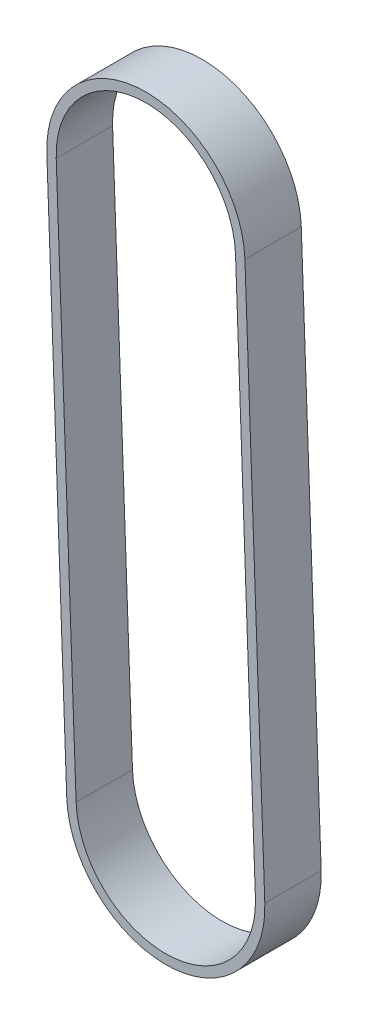
from build123d import *

# Parameters (mm, degrees)
EXTRUDE_THIN1_DEPTH = 9


with BuildPart() as part:
    # Sketch2 → Extrude-Thin1 (new body)
    with BuildSketch(Plane.XY):
        with BuildLine():
            Line((-13.106998523, -87.711544201), (-16.281998523, -0.269168392))
            ThreePointArc((-16.281998523, -0.269168392), (-1.042657551, 16.118538887), (15.345049728, 0.879197915))
            Line((15.345049728, 0.879197915), (18.520049728, -86.563177894))
            ThreePointArc((18.520049728, -86.563177894), (3.280708756, -102.950885173), (-13.106998523, -87.711544201))
        make_face()
        with BuildLine():
            Line((-11.607986338, -87.657115628), (-14.782986338, -0.21473982))
            ThreePointArc((-14.782986338, -0.21473982), (-0.988228979, 14.619526702), (13.846037543, 0.824769342))
            Line((13.846037543, 0.824769342), (17.021037543, -86.617606466))
            ThreePointArc((17.021037543, -86.617606466), (3.226280183, -101.451872988), (-11.607986338, -87.657115628))
        make_face(mode=Mode.SUBTRACT)
    extrude(amount=-EXTRUDE_THIN1_DEPTH)


solid = part.part
